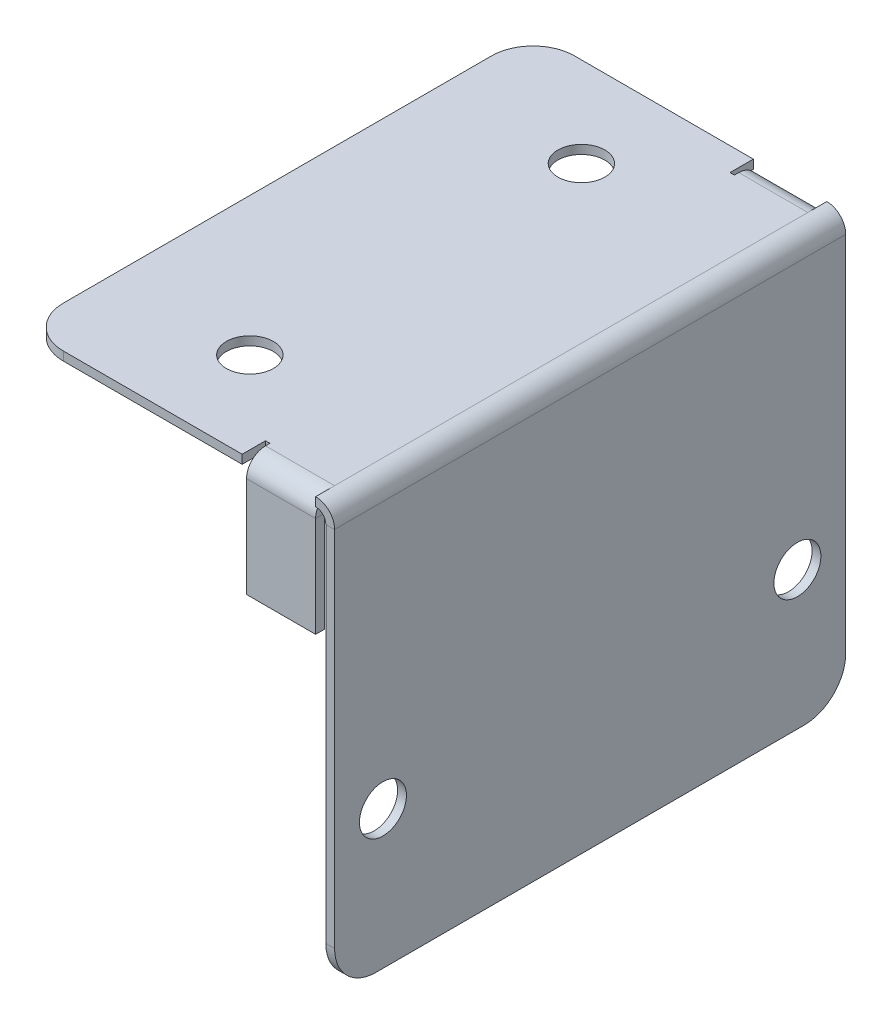
from build123d import *

# Parameters (mm, degrees)
SKETCH2_W                    = 37
SKETCH2_H                    = 30
BASE_FLANGE1_DEPTH           = 0.635
EDGE_FLANGE1_STRIP_W         = 4.0132
EDGE_FLANGE1_STRIP_H         = 0.635
EDGE_FLANGE1_STRIP_CUT_DEPTH = 37
EDGE_FLANGE1_DEPTH           = 37
EDGE_FLANGE2_START           = -6.6891
EDGE_FLANGE2_DEPTH           = 5.3175
EDGE_FLANGE2_2_DEPTH         = 0.3175
EDGE_FLANGE2_START_2         = -6.3716
EDGE_FLANGE2_3_DEPTH         = 5
EDGE_FLANGE3_START           = -6.6891
EDGE_FLANGE3_DEPTH           = 5.3175
EDGE_FLANGE3_2_DEPTH         = 0.3175
EDGE_FLANGE3_START_2         = -6.3716
EDGE_FLANGE3_3_DEPTH         = 5
SKETCH14_R                   = 1.7
CUT_EXTRUDE1_DEPTH           = 10
FILLET1_R                    = 3
SKETCH15_R                   = 1.7
CUT_EXTRUDE2_DEPTH           = 10


# Read off the part's stored shape, not the designer's step: Edge-Flange2, Edge-Flange3
# Sheet-metal steps are written as plain solids
with BuildPart() as part:
    # Sketch2 → Base-Flange1 (new body)
    with BuildSketch(Plane(origin=(0, 0, 0), x_dir=(0, 0, -1), z_dir=(1, 0, 0))):
        with Locations((18.5, -15)):
            Rectangle(SKETCH2_W, SKETCH2_H)
    extrude(amount=-BASE_FLANGE1_DEPTH)

    # Edge-Flange1 strip (across the edge) → Edge-Flange1 strip cut (cut)
    with BuildSketch(Plane(origin=(-0.635, 0, 0), x_dir=(0, -1, 0), z_dir=(0, 0, -1))):
        with Locations((-1.27, -0.3175)):
            Rectangle(EDGE_FLANGE1_STRIP_W, EDGE_FLANGE1_STRIP_H)
    extrude(amount=EDGE_FLANGE1_STRIP_CUT_DEPTH, mode=Mode.SUBTRACT)

    # Edge-Flange1 section (across the edge) → Edge-Flange1 (add)
    with BuildSketch(Plane(origin=(-0.635, 0, 0), x_dir=(0, -1, 0), z_dir=(0, 0, -1))):
        with BuildLine():
            Line((-0.635, 0.7366), (-0.635, 22))
            Line((-0.635, 22), (0, 22))
            Line((0, 22), (0, 0.7366))
            ThreePointArc((0, 0.7366), (0.215745145, 0.215745145), (0.7366, 0))
            Line((0.7366, 0), (0.7366, -0.635))
            ThreePointArc((0.7366, -0.635), (-0.233267661, -0.233267661), (-0.635, 0.7366))
        make_face()
    extrude(amount=EDGE_FLANGE1_DEPTH)

    # Edge-Flange2 outline → Edge-Flange2 (cut)
    with BuildSketch(Plane.YZ.offset(EDGE_FLANGE2_START)):
        with BuildLine():
            Line((0, 0), (0, -0.214574936))
            ThreePointArc((0, -0.214574936), (0.465815718, -0.711688642), (0.635, -1.3716))
            Line((0.635, -1.3716), (0.635, 0))
            Line((0.635, 0), (0, 0))
        make_face()
    extrude(amount=EDGE_FLANGE2_DEPTH, mode=Mode.SUBTRACT)

    # Edge-Flange2 2 outline → Edge-Flange2 2 (cut)
    with BuildSketch(Plane.YZ.offset(EDGE_FLANGE2_START)):
        with BuildLine():
            ThreePointArc((0.635, -1.3716), (0.465815718, -0.711688642), (0, -0.214574936))
            Line((0, -0.214574936), (0, -1.6891))
            Line((0, -1.6891), (0.635, -1.6891))
            Line((0.635, -1.6891), (0.635, -1.3716))
        make_face()
    extrude(amount=EDGE_FLANGE2_2_DEPTH, mode=Mode.SUBTRACT)

    # Edge-Flange2 3 outline → Edge-Flange2 3 (add)
    with BuildSketch(Plane.YZ.offset(EDGE_FLANGE2_START_2)):
        with BuildLine():
            Line((-0.7366, 0), (-8, 0))
            Line((-8, 0), (-8, -0.635))
            Line((-8, -0.635), (-0.7366, -0.635))
            ThreePointArc((-0.7366, -0.635), (-0.215745145, -0.850745145), (0, -1.3716))
            Line((0, -1.3716), (0, -0.214574936))
            ThreePointArc((0, -0.214574936), (-0.352991488, -0.054735896), (-0.7366, 0))
        make_face()
    extrude(amount=EDGE_FLANGE2_3_DEPTH)

    # Edge-Flange3 outline → Edge-Flange3 (cut)
    with BuildSketch(Plane.YZ.offset(EDGE_FLANGE3_START)):
        with BuildLine():
            ThreePointArc((0.635, -35.6284), (0.465815718, -36.288311358), (0, -36.785425064))
            Line((0, -36.785425064), (0, -37))
            Line((0, -37), (0.635, -37))
            Line((0.635, -37), (0.635, -35.6284))
        make_face()
    extrude(amount=EDGE_FLANGE3_DEPTH, mode=Mode.SUBTRACT)

    # Edge-Flange3 2 outline → Edge-Flange3 2 (cut)
    with BuildSketch(Plane.YZ.offset(EDGE_FLANGE3_START)):
        with BuildLine():
            Line((0, -35.3109), (0, -36.785425064))
            ThreePointArc((0, -36.785425064), (0.465815718, -36.288311358), (0.635, -35.6284))
            Line((0.635, -35.6284), (0.635, -35.3109))
            Line((0.635, -35.3109), (0, -35.3109))
        make_face()
    extrude(amount=EDGE_FLANGE3_2_DEPTH, mode=Mode.SUBTRACT)

    # Edge-Flange3 3 outline → Edge-Flange3 3 (add)
    with BuildSketch(Plane.YZ.offset(EDGE_FLANGE3_START_2)):
        with BuildLine():
            Line((-8, -37), (-0.7366, -37))
            ThreePointArc((-0.7366, -37), (-0.352991488, -36.945264104), (0, -36.785425064))
            Line((0, -36.785425064), (0, -35.6284))
            ThreePointArc((0, -35.6284), (-0.215745145, -36.149254855), (-0.7366, -36.365))
            Line((-0.7366, -36.365), (-8, -36.365))
            Line((-8, -36.365), (-8, -37))
        make_face()
    extrude(amount=EDGE_FLANGE3_3_DEPTH)

    # Sketch14 → Cut-Extrude1 (cut)
    with BuildSketch(Plane(origin=(0, 0, 0), x_dir=(0, 0, -1), z_dir=(1, 0, 0))):
        with Locations((3.5, -20)):
            Circle(SKETCH14_R)
        with Locations((33.5, -20)):
            Circle(SKETCH14_R)
    extrude(amount=-CUT_EXTRUDE1_DEPTH, mode=Mode.SUBTRACT)

    # Fillet1
    fillet1_edges = [part.edges().sort_by_distance(p)[0] for p in [
        (-22.635, 0.3175, 0),
        (-22.635, 0.3175, -37),
        (-0.3175, -30, -37),
        (-0.3175, -30, 0),
    ]]
    fillet(fillet1_edges, radius=FILLET1_R)

    # Sketch15 → Cut-Extrude2 (cut)
    with BuildSketch(Plane(origin=(0, 0.635, 0), x_dir=(1, 0, 0), z_dir=(0, 1, 0))):
        with Locations(Location((-12.635, 30.5, 0), (0, 0, 180))):
            Circle(SKETCH15_R)
        with Locations(Location((-12.635, 6.5, 0), (0, 0, 180))):
            Circle(SKETCH15_R)
    extrude(amount=-CUT_EXTRUDE2_DEPTH, mode=Mode.SUBTRACT)


solid = part.part
